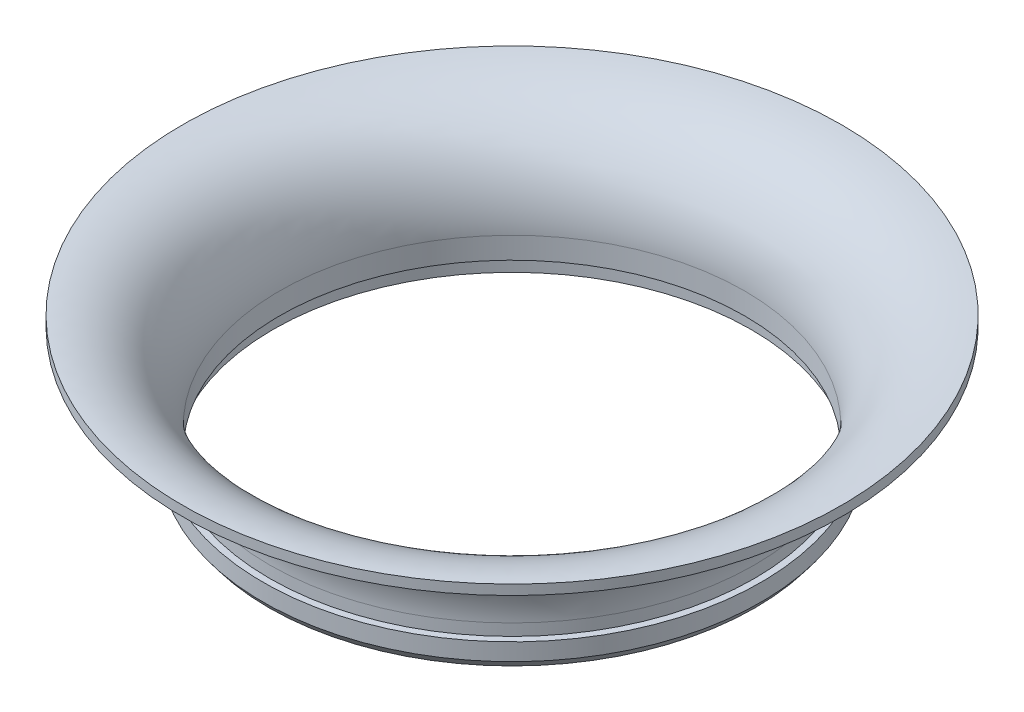
from build123d import *


with BuildPart() as part:
    # Sketch1 → Revolve1 (revolve)
    with BuildSketch(Plane.XY):
        with BuildLine():
            Line((-36.8, 0), (-36.2, 0))
            Line((-36.2, 0), (-36.2, 2.3))
            Line((-36.2, 2.3), (-35.2, 2.3))
            Line((-35.2, 2.3), (-35.2, 5.567567568))
            add(Edge.make_bspline(
                [(-35.2, 5.567567568), (-35.2, 12.055305215), (-39.368844713, 20), (-49.9, 20)],
                knots=[0, 0, 0, 0, 1, 1, 1, 1], degree=3))
            Line((-49.9, 20), (-49.9, 18.5))
            add(Edge.make_bspline(
                [(-36.7, 5.567567568), (-36.7, 6.318341013), (-36.817701615, 7.799266656), (-37.372441841, 10.100804691), (-38.321631752, 12.295488962), (-39.677113219, 14.297565099), (-41.455235776, 16.012654391), (-43.318785562, 17.139783824), (-45.069742181, 17.817216754), (-46.520830244, 18.199842188), (-47.855477063, 18.4019633), (-48.993806791, 18.485595325), (-49.601022523, 18.5), (-49.9, 18.5)],
                knots=[0, 0, 0, 0, 0.125, 0.25, 0.375, 0.5, 0.625, 0.75, 0.8125, 0.875, 0.9375, 0.96875, 1, 1, 1, 1], degree=3))
            Line((-36.7, 5.567567568), (-36.7, 3.8))
            Line((-36.7, 3.8), (-37.7, 3.8))
            Line((-37.7, 3.8), (-37.7, 1.2))
            Line((-37.7, 1.2), (-36.8, 0))
        make_face()
    revolve(axis=Axis((0, 0, 0), (0, 1, 0)))


solid = part.part
